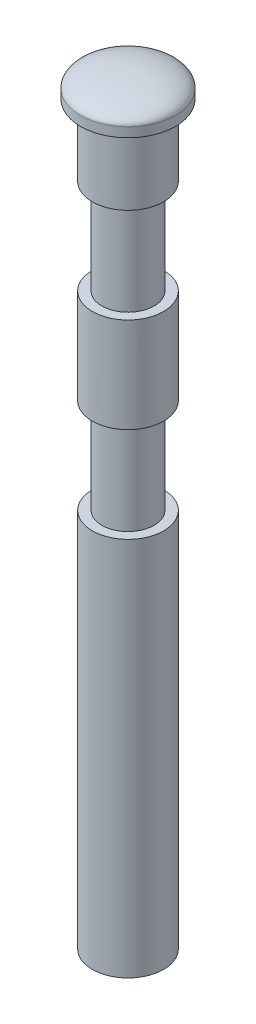
from build123d import *

# Parameters (mm, degrees)
SKETCH_2_R          = 1.288183927
SKETCH_2_R_2        = 0.75
CUT_EXTRUDE_1_DEPTH = 15.5
SKETCH_3_R          = 0.3
CUT_EXTRUDE_2_DEPTH = 4
SKETCH_8_W          = 0.393463538
SKETCH_8_H          = 2


with BuildPart() as part:
    # 草图1 → 旋转1 (revolve)
    with BuildSketch(Plane.XY):
        with BuildLine():
            Line((1, 0), (2, 0))
            Line((2, 0), (2, 15.7))
            add(Edge.make_bspline(
                [(2, 15.7), (2, 16), (1, 16)],
                knots=[0, 0, 0, 1.570796327, 1.570796327, 1.570796327], degree=2, weights=[1, 0.707106781, 1]))
            Line((1, 16), (1, 0))
        make_face()
    revolve(axis=Axis((1, 22.010661338, 0), (0, -1, 0)))

    # 草图2 → 切除-拉伸1 (cut)
    with BuildSketch(Plane.XZ):
        with Locations((1, 0)):
            Circle(SKETCH_2_R)
        with Locations((1, 0)):
            Circle(SKETCH_2_R_2, mode=Mode.SUBTRACT)
    extrude(amount=-CUT_EXTRUDE_1_DEPTH, mode=Mode.SUBTRACT)

    # 草图3 → 切除-拉伸2 (cut)
    with BuildSketch(Plane(origin=(0, 0, 0), x_dir=(-1, 0, 0), z_dir=(0, -1, 0))):
        with Locations((-1, 0)):
            Circle(SKETCH_3_R)
    extrude(amount=-CUT_EXTRUDE_2_DEPTH, mode=Mode.SUBTRACT)

    # 草图8 → 切除-旋转1 (revolve, cut)
    with BuildSketch(Plane.XY):
        with Locations((1.746731769, 13)):
            Rectangle(SKETCH_8_W, SKETCH_8_H)
        with Locations((1.746731769, 9)):
            Rectangle(SKETCH_8_W, SKETCH_8_H)
    revolve(axis=Axis((1, 0, 0), (0, 1, 0)), mode=Mode.SUBTRACT)


solid = part.part
